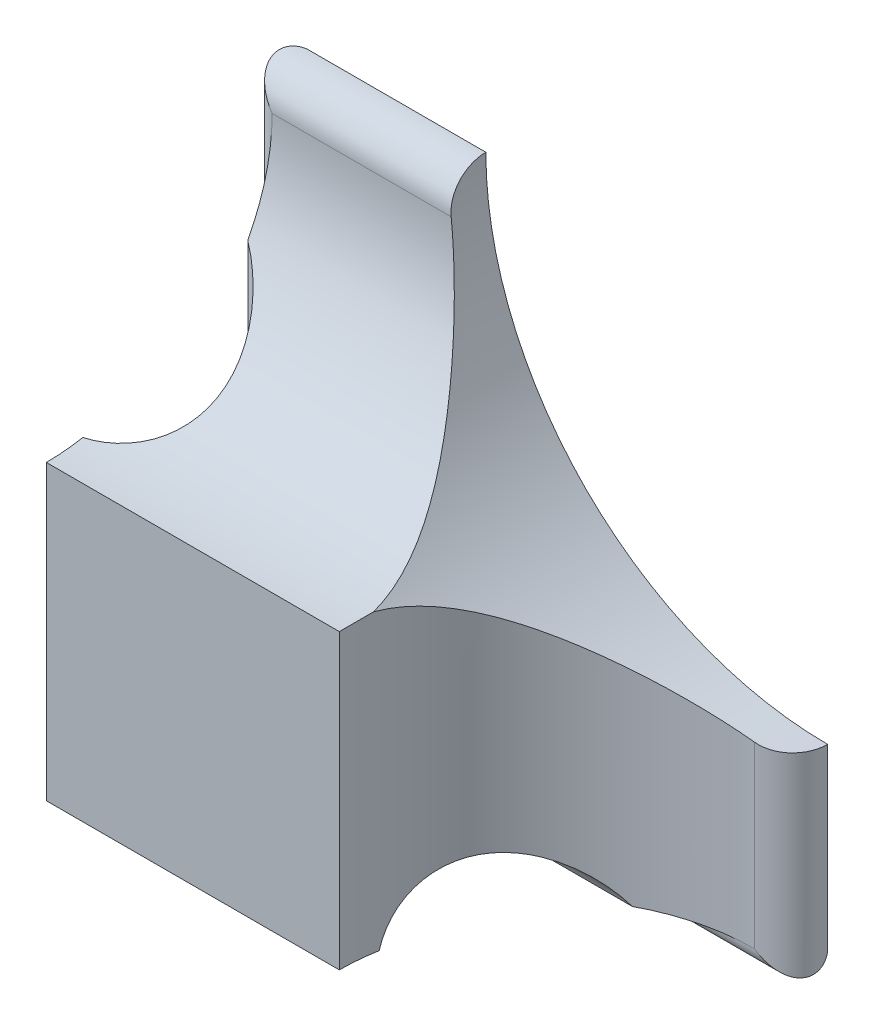
from build123d import *

# Parameters (mm, degrees)
EXTRUDE_494_DEPTH      = 10
CUT_EXTRUDE_1131_DEPTH = 28.026324626
CUT_EXTRUDE_1421_DEPTH = 28.026324626
CUT_EXTRUDE_START      = -3
CUT_EXTRUDE_1834_DEPTH = 31.026324789
CHAMFER_1_SIZE         = 0.5


with BuildPart() as part:
    # Эскиз1 → Extrude 494 (new body)
    with BuildSketch(Plane.XY):
        with BuildLine():
            Line((0, 0), (22, 0))
            Line((22, 0), (22, 8))
            ThreePointArc((22, 8), (16.642431947, 9.065686545), (12.100505063, 12.100505063))
            Line((12.100505063, 12.100505063), (0, 0))
        make_face()
    extrude_494 = extrude(amount=EXTRUDE_494_DEPTH)

    # Эскиз2 → Cut-Extrude 1131 (cut, through all)
    with BuildSketch(Plane(origin=(22, 0, 0), x_dir=(0, 0, -1), z_dir=(1, 0, 0))):
        with BuildLine():
            Line((-10, -1), (0, -1))
            Line((0, -1), (0, 0.75))
            ThreePointArc((0, 0.75), (-0.75, 0), (-1.5, 0.75))
            Line((-1.5, 0.75), (-2.5, 0.75))
            ThreePointArc((-2.5, 0.75), (-5.762519138, 2.475153108), (-8.5, 0))
            Line((-8.5, 0), (-10, 0))
            Line((-10, 0), (-10, -1))
        make_face()
    cut_extrude_1131 = extrude(amount=-CUT_EXTRUDE_1131_DEPTH, mode=Mode.SUBTRACT)

    # Эскиз3 → Cut-Extrude 1421 (cut, through all)
    with BuildSketch(Plane(origin=(0, 0, 0), x_dir=(1, 0, 0), z_dir=(0, 1, 0))):
        with BuildLine():
            Line((22, 0), (22, -10))
            Line((22, -10), (12, -10))
            ThreePointArc((12, -10), (14.48959236, -3.98959236), (20.5, -1.5))
            ThreePointArc((20.5, -1.5), (21.560660172, -1.060660172), (22, 0))
        make_face()
    cut_extrude_1421 = extrude(amount=CUT_EXTRUDE_1421_DEPTH, mode=Mode.SUBTRACT)

    # Эскиз5 → Cut-Extrude 1834 (cut)
    with BuildSketch(Plane(origin=(0, 0, 0), x_dir=(-1, 0, 0), z_dir=(0, 0, -1)).offset(CUT_EXTRUDE_START)):
        with BuildLine():
            ThreePointArc((-6.416547622, 6.416547622), (-7.487144673, 5.701197543), (-8.75, 5.45))
            Line((-8.75, 5.45), (-12.75, 5.45))
            Line((-12.75, 5.45), (-12.75, 4.05))
            Line((-12.75, 4.05), (-8.75, 4.05))
            ThreePointArc((-8.75, 4.05), (-6.951387868, 4.407766197), (-5.426598128, 5.426598128))
            Line((-5.426598128, 5.426598128), (-6.416547622, 6.416547622))
        make_face()
    cut_extrude_1834 = extrude(amount=CUT_EXTRUDE_1834_DEPTH, mode=Mode.SUBTRACT)

    # Зеркальное отражение1: Extrude 494, Cut-Extrude 1131, Cut-Extrude 1421, Cut-Extrude 1834 across plane
    add(extrude_494.mirror(Plane(origin=(12.100505063, 12.100505063, 10), x_dir=(0, 0, 1), z_dir=(0.7071067811865487, -0.7071067811865464, 0))))
    add(cut_extrude_1131.mirror(Plane(origin=(12.100505063, 12.100505063, 10), x_dir=(0, 0, 1), z_dir=(0.7071067811865487, -0.7071067811865464, 0))), mode=Mode.SUBTRACT)
    add(cut_extrude_1421.mirror(Plane(origin=(12.100505063, 12.100505063, 10), x_dir=(0, 0, 1), z_dir=(0.7071067811865487, -0.7071067811865464, 0))), mode=Mode.SUBTRACT)
    add(cut_extrude_1834.mirror(Plane(origin=(12.100505063, 12.100505063, 10), x_dir=(0, 0, 1), z_dir=(0.7071067811865487, -0.7071067811865464, 0))), mode=Mode.SUBTRACT)

    # Фаска1
    chamfer_1_edges = [part.edges().sort_by_distance(p)[0] for p in [
        (12.75, 4.75, 0),
        (10.75, 5.45, 0),
        (6.416547622, 6.416547622, 0),
        (10.75, 4.05, 0),
        (5.426598128, 5.426598128, 0),
        (5.45, 10.75, 0),
        (4.05, 10.75, 0),
        (4.75, 12.75, 0),
    ]]
    chamfer(chamfer_1_edges, length=CHAMFER_1_SIZE)


solid = part.part
